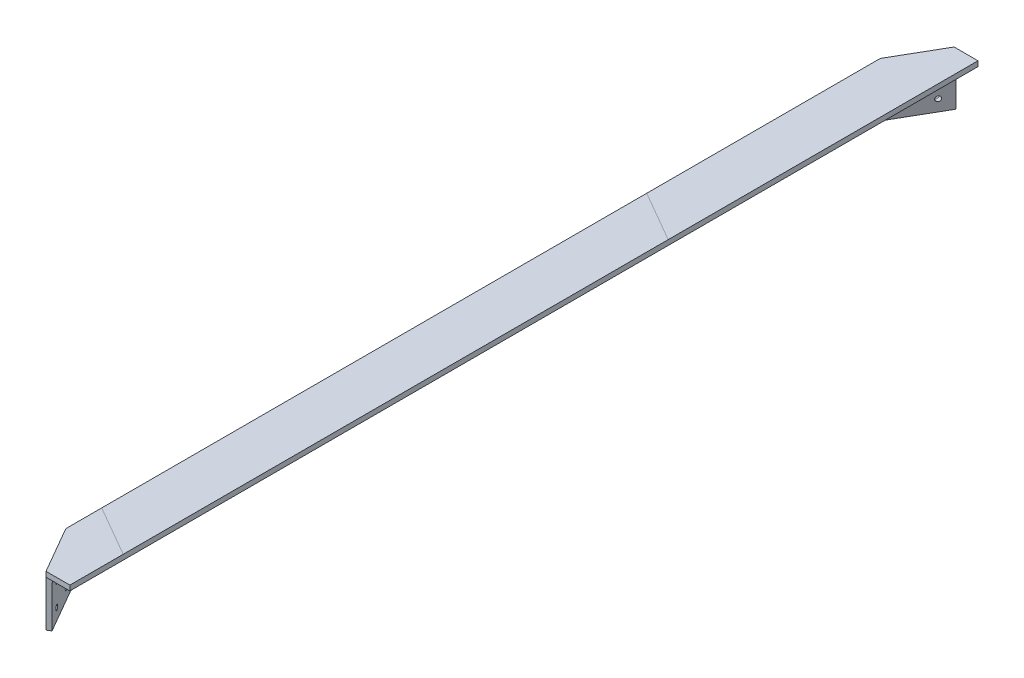
from build123d import *

# Parameters (mm, degrees)
BOSS_EXTRUDE1_DEPTH  = 640
BOSS_EXTRUDE2_DEPTH  = 8
BOSS_EXTRUDE3_DEPTH  = 72
SKETCH6_R            = 4
CUT_EXTRUDE1_DEPTH   = 8
FILLET1_R            = 10
FILLET2_R            = 8
FILLET1_OF_MIRROR1_R = 10
FILLET2_OF_MIRROR1_R = 8


with BuildPart() as part:
    # Sketch1 → Boss-Extrude1 (new body)
    with BuildSketch(Plane.XY):
        Polygon((-8, 8), (72, 8), (72, 0), (0, 0), (0, -72), (-8, -72), align=None)
    boss_extrude1 = extrude(amount=BOSS_EXTRUDE1_DEPTH)

    # Sketch3 → Boss-Extrude2 (add)
    with BuildSketch(Plane(origin=(0, 0, 0), x_dir=(1, 0, 0), z_dir=(0, 1, 0))):
        Polygon((-8, -640), (34.5, -713.612159322), (72, -713.612159322), (72, -640), align=None)
    boss_extrude2 = extrude(amount=BOSS_EXTRUDE2_DEPTH)

    # Sketch4 → Boss-Extrude3 (add)
    with BuildSketch(Plane.XZ):
        Polygon((-8, 640), (34.5, 713.612159322), (40.5, 710.148057707), (0, 640), align=None)
    boss_extrude3 = extrude(amount=BOSS_EXTRUDE3_DEPTH)

    # Sketch6 → Cut-Extrude1 (cut)
    with BuildSketch(Plane(origin=(-277.128129211, 0, 160), x_dir=(-0.4999999999999956, 0, -0.8660254037844413), z_dir=(0.8660254037844413, 0, -0.4999999999999956))):
        with Locations((-615.006258422, -18)):
            Circle(SKETCH6_R)
        with Locations((-574.506258422, -18)):
            Circle(SKETCH6_R)
        with Locations((-574.506258422, -54)):
            Circle(SKETCH6_R)
        with Locations((-615.006258422, -54)):
            Circle(SKETCH6_R)
    cut_extrude1 = extrude(amount=-CUT_EXTRUDE1_DEPTH, mode=Mode.SUBTRACT)

    # Fillet1
    fillet1_edges = [part.edges().sort_by_distance(p)[0] for p in [
        (-8, -32, 640),
        (0, -36, 640),
    ]]
    fillet(fillet1_edges, radius=FILLET1_R)

    # Fillet2
    fillet2_edges = [part.edges().sort_by_distance(p)[0] for p in [
        (0, 0, 318.660254038),
        (0.340741737, 0, 639.908698527),
        (20.919872981, 0, 676.234282891),
    ]]
    fillet(fillet2_edges, radius=FILLET2_R)

    # Mirror1: Boss-Extrude1, Boss-Extrude2, Boss-Extrude3, Cut-Extrude1 across plane
    add(boss_extrude1.mirror(Plane.XY))
    add(boss_extrude2.mirror(Plane.XY))
    add(boss_extrude3.mirror(Plane.XY))
    add(cut_extrude1.mirror(Plane.XY), mode=Mode.SUBTRACT)

    # Fillet1 of Mirror1
    fillet1_of_mirror1_edges = [part.edges().sort_by_distance(p)[0] for p in [
        (-8, -32, -640),
        (0, -36, -640),
    ]]
    fillet(fillet1_of_mirror1_edges, radius=FILLET1_OF_MIRROR1_R)

    # Fillet2 of Mirror1
    fillet2_of_mirror1_edges = [part.edges().sort_by_distance(p)[0] for p in [
        (0, 0, -318.660254038),
        (0.340741737, 0, -639.908698527),
        (20.919872981, 0, -676.234282891),
    ]]
    fillet(fillet2_of_mirror1_edges, radius=FILLET2_OF_MIRROR1_R)


solid = part.part
